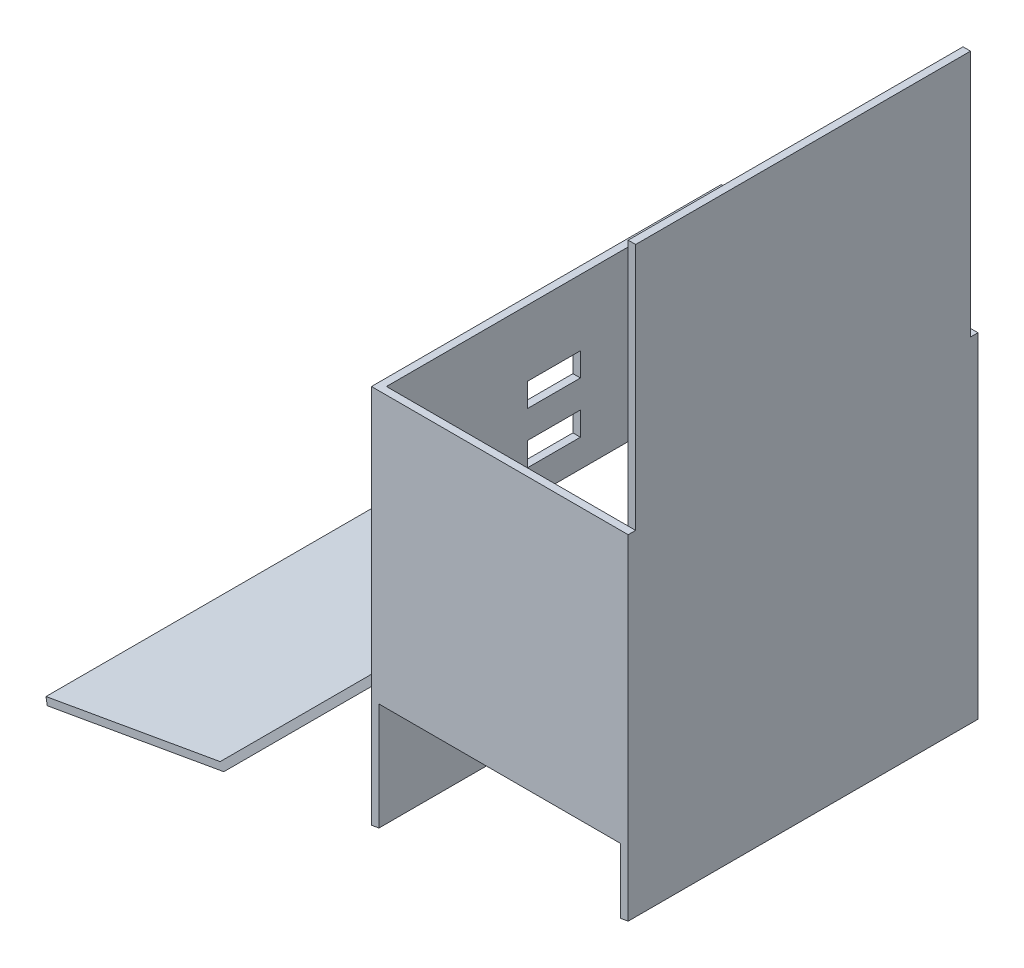
from build123d import *

# Parameters (mm, degrees)
BOSS_EXTRUDE1_REACH             = 677.751
SKETCH1_W                       = 217.7
SKETCH1_H                       = 296.7
SKETCH1_W_2                     = 205
SKETCH1_H_2                     = 284
BOSS_EXTRUDE4_REACH             = 373.096
BOSS_EXTRUDE4_DIRECTION_2_REACH = 373.096
SKETCH8_W                       = 6.35
SKETCH8_H                       = 284
BOSS_EXTRUDE5_DEPTH             = 210
CUT_EXTRUDE1_REACH              = 566.084
CUT_EXTRUDE1_DIRECTION_2_REACH  = 566.084
SKETCH6_W                       = 6.35
SKETCH6_H                       = 20
CUT_EXTRUDE2_DEPTH              = 22.5
SKETCH10_W                      = 205
SKETCH10_H                      = 384.449683147
CUT_EXTRUDE4_DEPTH              = 270


with BuildPart() as part:
    # Boss-Extrude1: up to this plane
    boss_extrude1_end = Plane(origin=(51.828623609, -293.934730807, 0), z_dir=(-0.17364817766693072, 0.984807753012208, 0))
    # Sketch1 → Boss-Extrude1 (new, up to the surface)
    with BuildSketch(Plane(origin=(0, 0, 0), x_dir=(1, 0, 0), z_dir=(0, 1, 0)), mode=Mode.PRIVATE) as boss_extrude1_sk1:
        Rectangle(SKETCH1_W, SKETCH1_H)
        Rectangle(SKETCH1_W_2, SKETCH1_H_2, mode=Mode.SUBTRACT)
    boss_extrude1_tool1 = split(extrude(boss_extrude1_sk1.sketch, amount=-BOSS_EXTRUDE1_REACH, mode=Mode.PRIVATE), bisect_by=boss_extrude1_end, keep=Keep.BOTH, mode=Mode.PRIVATE)
    add(boss_extrude1_tool1.solids().sort_by_distance((0, 0, -144.669998))[0])

    # Boss-Extrude4: up to this face of the body (flat: up to its plane)
    boss_extrude4_end = Plane(part.part.faces().sort_by_distance((-2.037498325, -151.716390725, -142))[0])
    # Sketch7 → Boss-Extrude4 (add, up to the picked face)
    with BuildSketch(Plane.XY, mode=Mode.PRIVATE) as boss_extrude4_sk1:
        Polygon((102.5, 0), (-243.511090961, -346.011090961), (-391.232253913, -372.058317611), (-390.129587984, -378.311846842), (-240.43669484, -351.916950961), (102.5, -8.980256121), align=None)
    boss_extrude4_tool1 = split(extrude(boss_extrude4_sk1.sketch, amount=-BOSS_EXTRUDE4_REACH, mode=Mode.PRIVATE), bisect_by=boss_extrude4_end, keep=Keep.BOTH, mode=Mode.PRIVATE)
    add(boss_extrude4_tool1.solids().sort_by(Axis((-66.107299, -177.403792, 0), (0, 0, -1)))[0])

    # Boss-Extrude4 direction 2: up to this face of the body (flat: up to its plane)
    boss_extrude4_direction_2_end = Plane(part.part.faces().sort_by_distance((-2.037498325, -151.716390725, 142))[0])
    # Sketch7 → Boss-Extrude4 direction 2 (add, up to the picked face)
    with BuildSketch(Plane.XY, mode=Mode.PRIVATE) as boss_extrude4_direction_2_sk1:
        Polygon((102.5, 0), (-243.511090961, -346.011090961), (-391.232253913, -372.058317611), (-390.129587984, -378.311846842), (-240.43669484, -351.916950961), (102.5, -8.980256121), align=None)
    boss_extrude4_direction_2_tool1 = split(extrude(boss_extrude4_direction_2_sk1.sketch, amount=BOSS_EXTRUDE4_DIRECTION_2_REACH, mode=Mode.PRIVATE), bisect_by=boss_extrude4_direction_2_end, keep=Keep.BOTH, mode=Mode.PRIVATE)
    add(boss_extrude4_direction_2_tool1.solids().sort_by(Axis((-66.107299, -177.403792, 0), (0, 0, 1)))[0])

    # Sketch8 → Boss-Extrude5 (add)
    with BuildSketch(Plane(origin=(0, 0, 0), x_dir=(1, 0, 0), z_dir=(0, 1, 0))):
        with Locations((105.675, 0)):
            Rectangle(SKETCH8_W, SKETCH8_H)
    extrude(amount=BOSS_EXTRUDE5_DEPTH)

    # Cut-Extrude1: up to this face of the body (flat: up to its plane)
    cut_extrude1_end = Plane(part.part.faces().sort_by_distance((-34.166666667, -68.333333333, -142))[0])
    # Sketch4 → Cut-Extrude1 (cut, up to the picked face)
    with BuildSketch(Plane.XY, mode=Mode.PRIVATE) as cut_extrude1_sk1:
        Polygon((-108.85, -211.35), (-102.5, -205), (-102.5, -143), (-108.85, -143), align=None)
    cut_extrude1_tool1 = split(extrude(cut_extrude1_sk1.sketch, amount=-CUT_EXTRUDE1_REACH, mode=Mode.PRIVATE), bisect_by=cut_extrude1_end, keep=Keep.BOTH, mode=Mode.PRIVATE)
    add(cut_extrude1_tool1.solids().sort_by(Axis((-105.726557, -175.613278, 0), (0, 0, -1)))[0], mode=Mode.SUBTRACT)

    # Cut-Extrude1 direction 2: up to this face of the body (flat: up to its plane)
    cut_extrude1_direction_2_end = Plane(part.part.faces().sort_by_distance((-34.166666667, -68.333333333, 142))[0])
    # Sketch4 → Cut-Extrude1 direction 2 (cut, up to the picked face)
    with BuildSketch(Plane.XY, mode=Mode.PRIVATE) as cut_extrude1_direction_2_sk1:
        Polygon((-108.85, -211.35), (-102.5, -205), (-102.5, -143), (-108.85, -143), align=None)
    cut_extrude1_direction_2_tool1 = split(extrude(cut_extrude1_direction_2_sk1.sketch, amount=CUT_EXTRUDE1_DIRECTION_2_REACH, mode=Mode.PRIVATE), bisect_by=cut_extrude1_direction_2_end, keep=Keep.BOTH, mode=Mode.PRIVATE)
    add(cut_extrude1_direction_2_tool1.solids().sort_by(Axis((-105.726557, -175.613278, 0), (0, 0, 1)))[0], mode=Mode.SUBTRACT)

    # Sketch6 → Cut-Extrude2 (cut, symmetric)
    with BuildSketch(Plane.XY):
        with Locations((-105.675, -109.5)):
            Rectangle(SKETCH6_W, SKETCH6_H)
        with Locations((-105.675, -66)):
            Rectangle(SKETCH6_W, SKETCH6_H)
    extrude(amount=CUT_EXTRUDE2_DEPTH, both=True, mode=Mode.SUBTRACT)

    # Sketch10 → Cut-Extrude4 (cut)
    with BuildSketch(Plane(origin=(0, -500, 0), x_dir=(1, 0, 0), z_dir=(0, 1, 0))):
        with Locations((0, -10.251991551)):
            Rectangle(SKETCH10_W, SKETCH10_H)
    extrude(amount=CUT_EXTRUDE4_DEPTH, mode=Mode.SUBTRACT)


solid = part.part
